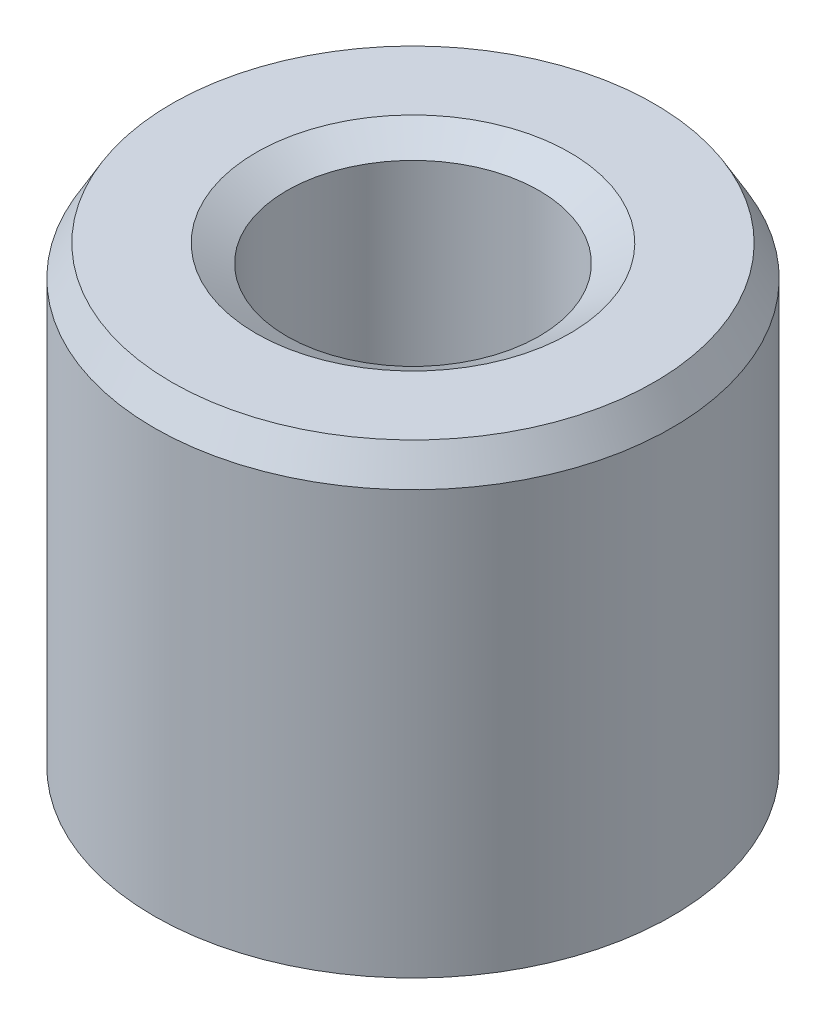
from build123d import *
from OCP.BRepFilletAPI import BRepFilletAPI_MakeChamfer

# Parameters (mm, degrees)
SKETCH1_R           = 22.5
BOSS_EXTRUDE1_DEPTH = 40.938667201
SKETCH2_R           = 10.966340849
CUT_EXTRUDE1_DEPTH  = 52.850501176
CHAMFER1_SIZE       = 2.662001196
CHAMFER1_SIZE2      = 1.536907107


with BuildPart() as part:
    # Sketch1 → Boss-Extrude1 (new body)
    with BuildSketch(Plane(origin=(0, 0, 0), x_dir=(1, 0, 0), z_dir=(0, 1, 0))):
        Circle(SKETCH1_R)
    extrude(amount=BOSS_EXTRUDE1_DEPTH)

    # Sketch2 → Cut-Extrude1 (cut, through all)
    with BuildSketch(Plane(origin=(0, 0, 0), x_dir=(1, 0, 0), z_dir=(0, 1, 0))):
        Circle(SKETCH2_R)
    extrude(amount=CUT_EXTRUDE1_DEPTH, mode=Mode.SUBTRACT)

    # Chamfer1: one chamfer whose edges measure the first distance from different faces: ONE call of the kernel's chamfer builder (chamfer() names one face for all edges)
    chamfer1_edges_1 = [part.edges().sort_by_distance(p)[0] for p in [
        (-10.966340849, 40.938667201, 0),
    ]]
    chamfer1_side_1 = [part.faces().sort_by_distance(p)[0] for p in [
        (-21.863603897, 40.938667201, 0),
    ]]
    chamfer1_edges_2 = [part.edges().sort_by_distance(p)[0] for p in [
        (-10.966340849, 0, 0),
    ]]
    chamfer1_side_2 = [part.faces().sort_by_distance(p)[0] for p in [
        (-10.966340849, 20.4693336, 0),
    ]]
    chamfer1_edges_3 = [part.edges().sort_by_distance(p)[0] for p in [
        (-22.5, 0, 0),
    ]]
    chamfer1_side_3 = [part.faces().sort_by_distance(p)[0] for p in [
        (-21.863603897, 0, 0),
    ]]
    chamfer1_edges_4 = [part.edges().sort_by_distance(p)[0] for p in [
        (-22.5, 40.938667201, 0),
    ]]
    chamfer1_side_4 = [part.faces().sort_by_distance(p)[0] for p in [
        (-22.5, 20.4693336, 0),
    ]]
    chamfer1 = BRepFilletAPI_MakeChamfer(part.part.solid().wrapped)
    for e in chamfer1_edges_1:
        chamfer1.Add(CHAMFER1_SIZE, CHAMFER1_SIZE2, e.wrapped, chamfer1_side_1[0].wrapped)  # the first distance lies on this face
    for e in chamfer1_edges_2:
        chamfer1.Add(CHAMFER1_SIZE, CHAMFER1_SIZE2, e.wrapped, chamfer1_side_2[0].wrapped)  # the first distance lies on this face
    for e in chamfer1_edges_3:
        chamfer1.Add(CHAMFER1_SIZE, CHAMFER1_SIZE2, e.wrapped, chamfer1_side_3[0].wrapped)  # the first distance lies on this face
    for e in chamfer1_edges_4:
        chamfer1.Add(CHAMFER1_SIZE, CHAMFER1_SIZE2, e.wrapped, chamfer1_side_4[0].wrapped)  # the first distance lies on this face
    add(Compound.cast(chamfer1.Shape()), mode=Mode.REPLACE)


solid = part.part
